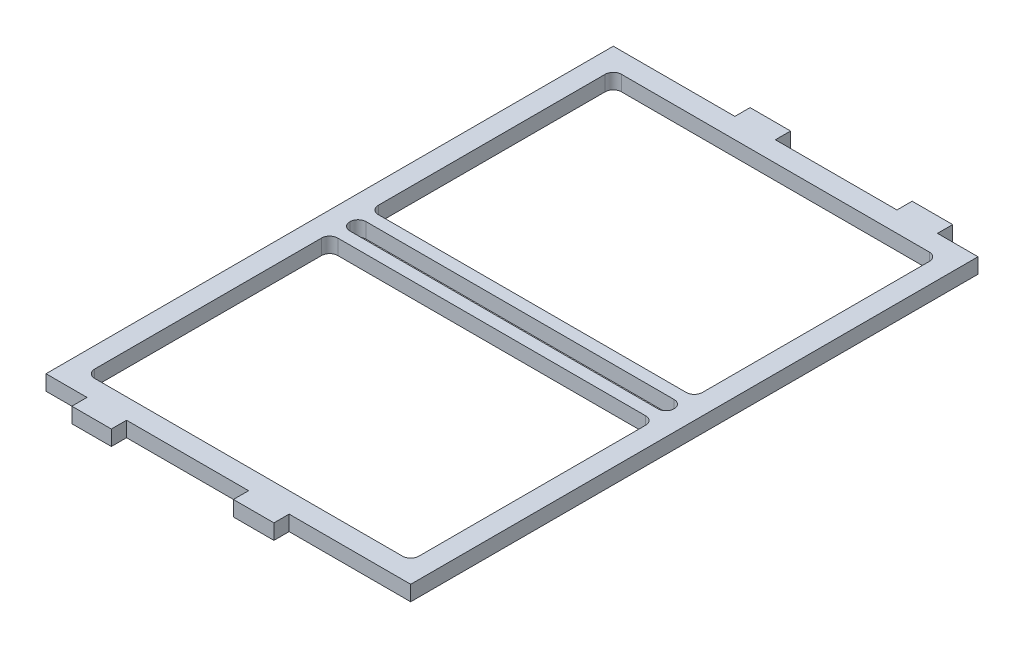
from build123d import *

# Parameters (mm, degrees)
SKETCH1_W           = 114.3
SKETCH1_H           = 177.8
SKETCH1_W_2         = 101.6
SKETCH1_H_2         = 165.1
BOSS_EXTRUDE1_DEPTH = 4.7625
SKETCH2_W           = 12.38677804
SKETCH2_H           = 4.7625
SKETCH2_W_2         = 12.7
BOSS_EXTRUDE2_DEPTH = 4.7625
SKETCH3_W           = 12.7
SKETCH3_H           = 4.7625
BOSS_EXTRUDE3_DEPTH = 4.7625
FILLET1_R           = 2.54
SKETCH5_W           = 114.3
SKETCH5_H           = 12.7
SKETCH5_W_2         = 101.6
SKETCH5_H_2         = 5.08
BOSS_EXTRUDE5_DEPTH = 4.7625
FILLET3_R           = 2.54


with BuildPart() as part:
    # Sketch1 → Boss-Extrude1 (new body)
    with BuildSketch(Plane(origin=(0, 0, 0), x_dir=(1, 0, 0), z_dir=(0, 1, 0))):
        Rectangle(SKETCH1_W, SKETCH1_H)
        Rectangle(SKETCH1_W_2, SKETCH1_H_2, mode=Mode.SUBTRACT)
    extrude(amount=BOSS_EXTRUDE1_DEPTH)

    # Sketch2 → Boss-Extrude2 (add)
    with BuildSketch(Plane.XY.offset(88.9)):
        with Locations((-38.1, 2.38125)):
            Rectangle(SKETCH2_W, SKETCH2_H)
        with Locations((12.7, 2.38125)):
            Rectangle(SKETCH2_W_2, SKETCH2_H)
    extrude(amount=BOSS_EXTRUDE2_DEPTH)

    # Sketch3 → Boss-Extrude3 (add)
    with BuildSketch(Plane(origin=(0, 0, -88.9), x_dir=(-1, 0, 0), z_dir=(0, 0, -1))):
        with Locations((-38.1, 2.38125)):
            Rectangle(SKETCH3_W, SKETCH3_H)
        with Locations((12.7, 2.38125)):
            Rectangle(SKETCH3_W, SKETCH3_H)
    extrude(amount=BOSS_EXTRUDE3_DEPTH)

    # Fillet1
    fillet1_edges = [part.edges().sort_by_distance(p)[0] for p in [
        (50.8, 2.38125, 82.55),
        (50.8, 2.38125, -82.55),
        (-50.8, 2.38125, -82.55),
        (-50.8, 2.38125, 82.55),
    ]]
    fillet(fillet1_edges, radius=FILLET1_R)

    # Sketch5 → Boss-Extrude5 (add)
    with BuildSketch(Plane.XZ):
        Rectangle(SKETCH5_W, SKETCH5_H)
        Rectangle(SKETCH5_W_2, SKETCH5_H_2, mode=Mode.SUBTRACT)
    extrude(amount=-BOSS_EXTRUDE5_DEPTH)

    # Fillet3
    fillet3_edges = [part.edges().sort_by_distance(p)[0] for p in [
        (-50.8, 2.38125, 6.35),
        (-50.8, 2.38125, -6.35),
        (50.8, 2.38125, -6.35),
        (50.8, 2.38125, 6.35),
        (50.8, 2.38125, -2.54),
        (-50.8, 2.38125, -2.54),
        (-50.8, 2.38125, 2.54),
        (50.8, 2.38125, 2.54),
    ]]
    fillet(fillet3_edges, radius=FILLET3_R - 0.0001)  # a hair under: the kernel refuses the full size


solid = part.part
